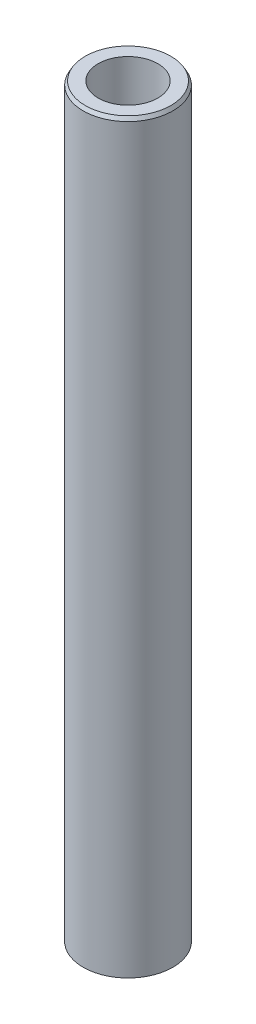
from build123d import *
from OCP.BRepFilletAPI import BRepFilletAPI_MakeChamfer

# Parameters (mm, degrees)
SKETCH1_R           = 30
BOSS_EXTRUDE1_DEPTH = 499.981358573
SKETCH2_R           = 19.957082807
CUT_EXTRUDE1_DEPTH  = 502.778196936
CHAMFER1_SIZE       = 2.401427492
CHAMFER1_SIZE2      = 1.386464809


with BuildPart() as part:
    # Sketch1 → Boss-Extrude1 (new body)
    with BuildSketch(Plane(origin=(0, 0, 0), x_dir=(1, 0, 0), z_dir=(0, 1, 0))):
        Circle(SKETCH1_R)
    extrude(amount=BOSS_EXTRUDE1_DEPTH)

    # Sketch2 → Cut-Extrude1 (cut, through all)
    with BuildSketch(Plane(origin=(0, 0, 0), x_dir=(1, 0, 0), z_dir=(0, 1, 0))):
        Circle(SKETCH2_R)
    extrude(amount=CUT_EXTRUDE1_DEPTH, mode=Mode.SUBTRACT)

    # Chamfer1: one chamfer whose edges measure the first distance from different faces: ONE call of the kernel's chamfer builder (chamfer() names one face for all edges)
    chamfer1_edges_1 = [part.edges().sort_by_distance(p)[0] for p in [
        (-30, 499.981358573, 0),
    ]]
    chamfer1_side_1 = [part.faces().sort_by_distance(p)[0] for p in [
        (-30, 249.990679286, 0),
    ]]
    chamfer1_edges_2 = [part.edges().sort_by_distance(p)[0] for p in [
        (-30, 0, 0),
    ]]
    chamfer1_side_2 = [part.faces().sort_by_distance(p)[0] for p in [
        (-29.151471863, 0, 0),
    ]]
    chamfer1 = BRepFilletAPI_MakeChamfer(part.part.solid().wrapped)
    for e in chamfer1_edges_1:
        chamfer1.Add(CHAMFER1_SIZE, CHAMFER1_SIZE2, e.wrapped, chamfer1_side_1[0].wrapped)  # the first distance lies on this face
    for e in chamfer1_edges_2:
        chamfer1.Add(CHAMFER1_SIZE, CHAMFER1_SIZE2, e.wrapped, chamfer1_side_2[0].wrapped)  # the first distance lies on this face
    add(Compound.cast(chamfer1.Shape()), mode=Mode.REPLACE)


solid = part.part
